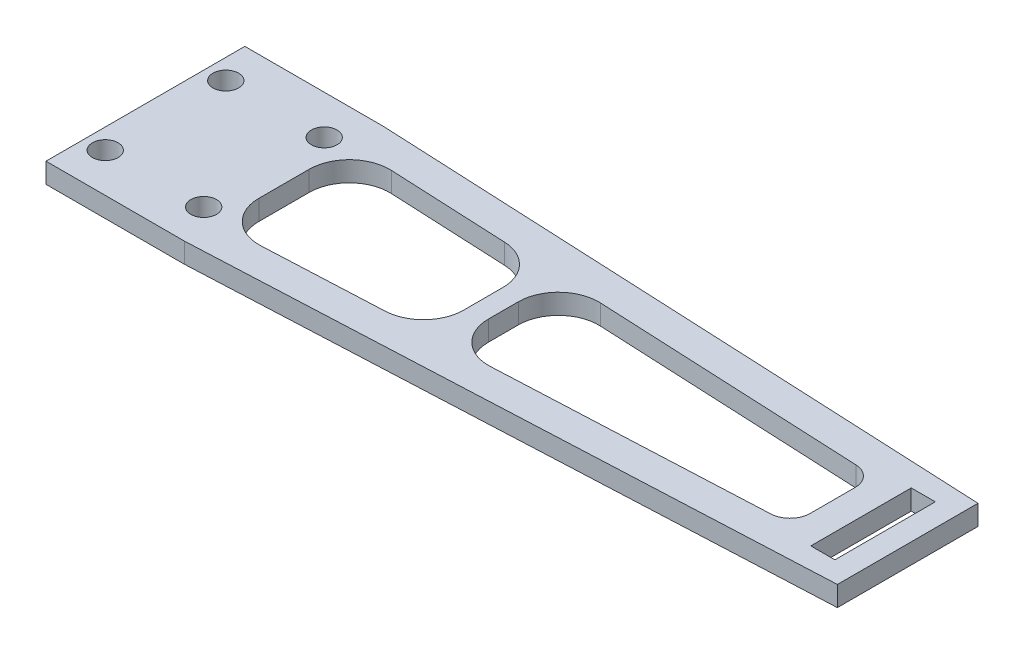
from build123d import *

# Parameters (mm, degrees)
SKETCH1_W           = 34.5
SKETCH1_H           = 49.5
BOSS_EXTRUDE1_DEPTH = 5
SKETCH2_R           = 3.2
CUT_EXTRUDE1_DEPTH  = 5
SKETCH3_W           = 6
SKETCH3_H           = 25
BOSS_EXTRUDE2_DEPTH = 5
FILLET1_R           = 10
FILLET2_R           = 5


with BuildPart() as part:
    # Sketch1 → Boss-Extrude1 (new body)
    with BuildSketch(Plane(origin=(0, 0, 0), x_dir=(1, 0, 0), z_dir=(0, 1, 0))):
        with Locations((17.25, 24.75)):
            Rectangle(SKETCH1_W, SKETCH1_H)
    extrude(amount=BOSS_EXTRUDE1_DEPTH)

    # Sketch2 → Cut-Extrude1 (cut)
    with BuildSketch(Plane(origin=(0, 5, 0), x_dir=(1, 0, 0), z_dir=(0, 1, 0))):
        with Locations((5, 39.75)):
            Circle(SKETCH2_R)
        with Locations((5, 9.75)):
            Circle(SKETCH2_R)
        with Locations((29.5, 9.75)):
            Circle(SKETCH2_R)
        with Locations((29.5, 39.75)):
            Circle(SKETCH2_R)
    extrude(amount=-CUT_EXTRUDE1_DEPTH, mode=Mode.SUBTRACT)

    # Sketch3 → Boss-Extrude2 (add)
    with BuildSketch(Plane(origin=(0, 5, 0), x_dir=(1, 0, 0), z_dir=(0, 1, 0))):
        Polygon((189.75, 42.25), (34.5, 49.5), (34.5, 41.491281612), (84.094915791, 39.175254948), (84.094915791, 10.324745052), (34.5, 8.008718388), (34.5, 0), (189.75, 7.25), align=None)
        Polygon((171.053500921, 14.385612956), (89.094915791, 10.558239416), (89.094915791, 38.941760584), (171.053500921, 35.114387044), align=None, mode=Mode.SUBTRACT)
        with Locations((181.13, 24.75)):
            Rectangle(SKETCH3_W, SKETCH3_H, mode=Mode.SUBTRACT)
    extrude(amount=-BOSS_EXTRUDE2_DEPTH)

    # Fillet1
    fillet1_edges = [part.edges().sort_by_distance(p)[0] for p in [
        (89.094915791, 2.5, -10.558239416),
        (89.094915791, 2.5, -38.941760584),
        (84.094915791, 2.5, -10.324745052),
        (84.094915791, 2.5, -39.175254948),
        (34.5, 2.5, -41.491281612),
        (34.5, 2.5, -8.008718388),
    ]]
    fillet(fillet1_edges, radius=FILLET1_R)

    # Fillet2
    fillet2_edges = [part.edges().sort_by_distance(p)[0] for p in [
        (171.053500921, 2.5, -14.385612956),
        (171.053500921, 2.5, -35.114387044),
    ]]
    fillet(fillet2_edges, radius=FILLET2_R)


solid = part.part
